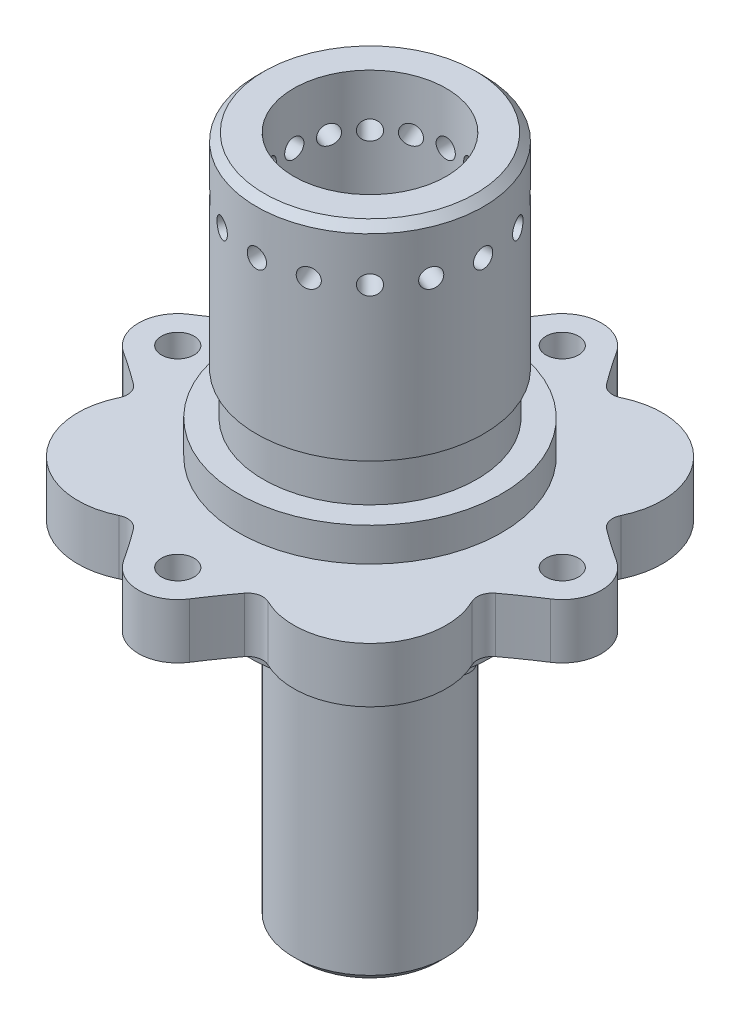
from build123d import *

# Parameters (mm, degrees)
SKETCH5_W                     = 15.875
SKETCH5_H                     = 79.375
DRIVE_PIN_HOLES_D             = 6.8
DRIVE_PIN_HOLES_PATTERN_COUNT = 4
FLANGE_SUPPORT_CUT_REACH      = 105.717
SKETCH8_R                     = 52.5
SKETCH10_R                    = 25.0825
BRAKE_HAT_HEX_DEPTH           = 4.7625
F_5_16_CLEARANCE_HOLE1_D      = 8.4328
SKETCH14_R                    = 2
PIN_HOLES_DEPTH               = 100.418201231
PIN_HOLE_PATTERN_COUNT        = 16
FILLET1_R                     = 3.175
FILLET2_R                     = 3.175


with BuildPart() as part:
    # Sketch1 → Bearing Shaft/Flange Support (revolve)
    with BuildSketch(Plane(origin=(0, 0, 0), x_dir=(0, 0, -1), z_dir=(1, 0, 0))):
        Polygon((0, 0), (-27.254672075, 0), (-25.0825, -12.319), (-25.0825, -17.0815), (-15.875, -17.0815), (-15.875, -70.83298), (-14.2875, -72.42048), (0, -72.42048), align=None)
    revolve(axis=Axis((0, 0, 0), (0, 1, 0)))

    # Sketch2 → Drive Pin Support (revolve)
    with BuildSketch(Plane(origin=(0, 0, 0), x_dir=(0, 0, -1), z_dir=(1, 0, 0))):
        Polygon((0, 0), (-52.5, 0), (-52.5, 11.43), (-27.4096, 11.43), (-27.4096, 18.43), (-22.225, 18.43), (-22.225, 27.305), (-23.61946, 27.305), (-23.61946, 68.2625), (-22.03196, 69.85), (0, 69.85), align=None)
    revolve(axis=Axis((0, 0, 0), (0, 1, 0)))

    # Sketch5 → Center Mass Removal (revolve, cut)
    with BuildSketch(Plane(origin=(0, 0, 0), x_dir=(0, 0, -1), z_dir=(1, 0, 0))):
        with Locations((7.9375, 30.1625)):
            Rectangle(SKETCH5_W, SKETCH5_H)
    revolve(axis=Axis((0, 0, 0), (0, -1, 0)), mode=Mode.SUBTRACT)

    # Drive Pin Holes (through all)
    with Locations(Plane(origin=(0, 0, 0), x_dir=(-1, 0, 0), z_dir=(0, -1, 0))):
        with Locations((0, -40)):
            drive_pin_holes = Hole(DRIVE_PIN_HOLES_D / 2)

    # Drive Pin Holes Pattern: Drive Pin Holes ×4 about axis
    drive_pin_holes_pattern_axis = Axis((0, 0, 0), (0, -1, 0))
    for i in range(1, DRIVE_PIN_HOLES_PATTERN_COUNT):
        add(drive_pin_holes.rotate(drive_pin_holes_pattern_axis, i * 360 / DRIVE_PIN_HOLES_PATTERN_COUNT), mode=Mode.SUBTRACT)

    # Sketch8 → Flange Support Cut (cut, up to next)
    with BuildSketch(Plane.XZ, mode=Mode.PRIVATE) as flange_support_cut_sk1:
        Circle(SKETCH8_R)
        with BuildLine():
            ThreePointArc((-6.851776468, 44.436165629), (0, 48.1625), (6.851776468, 44.436165629))
            ThreePointArc((6.851776468, 44.436165629), (9.964767607, 39.850591878), (13.274865482, 35.405206349))
            ThreePointArc((13.274865482, 35.405206349), (33.675960454, 33.675960454), (35.405206349, 13.274865482))
            ThreePointArc((35.405206349, 13.274865482), (39.850591878, 9.964767607), (44.436165629, 6.851776468))
            ThreePointArc((44.436165629, 6.851776468), (48.1625, 0), (44.436165629, -6.851776468))
            ThreePointArc((44.436165629, -6.851776468), (39.850591878, -9.964767607), (35.405206349, -13.274865482))
            ThreePointArc((35.405206349, -13.274865482), (33.675960454, -33.675960454), (13.274865482, -35.405206349))
            ThreePointArc((13.274865482, -35.405206349), (9.964767607, -39.850591878), (6.851776468, -44.436165629))
            ThreePointArc((6.851776468, -44.436165629), (0, -48.1625), (-6.851776468, -44.436165629))
            ThreePointArc((-6.851776468, -44.436165629), (-9.964767607, -39.850591878), (-13.274865482, -35.405206349))
            ThreePointArc((-13.274865482, -35.405206349), (-33.675960454, -33.675960454), (-35.405206349, -13.274865482))
            ThreePointArc((-35.405206349, -13.274865482), (-39.850591878, -9.964767607), (-44.436165629, -6.851776468))
            ThreePointArc((-44.436165629, -6.851776468), (-48.1625, 0), (-44.436165629, 6.851776468))
            ThreePointArc((-44.436165629, 6.851776468), (-39.850591878, 9.964767607), (-35.405206349, 13.274865482))
            ThreePointArc((-35.405206349, 13.274865482), (-33.675960454, 33.675960454), (-13.274865482, 35.405206349))
            ThreePointArc((-13.274865482, 35.405206349), (-9.964767607, 39.850591878), (-6.851776468, 44.436165629))
        make_face(mode=Mode.SUBTRACT)
    flange_support_cut_tool1 = extrude(flange_support_cut_sk1.sketch, amount=-FLANGE_SUPPORT_CUT_REACH, mode=Mode.PRIVATE) & part.part
    add(flange_support_cut_tool1.solids().sort_by_distance((-51.015076, 0, 0))[0], mode=Mode.SUBTRACT)

    # Sketch10 → Brake Hat Hex (cut)
    with BuildSketch(Plane.XZ.offset(17.0815)):
        Circle(SKETCH10_R)
        Polygon((10.631905207, -18.415), (21.263810414, 0), (10.631905207, 18.415), (-10.631905207, 18.415), (-21.263810414, 0), (-10.631905207, -18.415), align=None, mode=Mode.SUBTRACT)
    extrude(amount=-BRAKE_HAT_HEX_DEPTH, mode=Mode.SUBTRACT)

    # 5/16 Clearance Hole1 (through all)
    with Locations(Plane(origin=(0, -72.42048, 0), x_dir=(-1, 0, 0), z_dir=(0, -1, 0))):
        with Locations((0, 0)):
            Hole(F_5_16_CLEARANCE_HOLE1_D / 2)

    # Sketch14 → Pin Holes (cut, through all)
    with BuildSketch(Plane(origin=(0, 0, 0), x_dir=(0, 0, -1), z_dir=(1, 0, 0))):
        with Locations((0, 59.05)):
            Circle(SKETCH14_R)
    pin_holes = extrude(amount=-PIN_HOLES_DEPTH, mode=Mode.SUBTRACT)

    # Pin Hole Pattern: Pin Holes ×16 about axis
    pin_hole_pattern_axis = Axis((0, 0, 0), (0, -1, 0))
    for i in range(1, PIN_HOLE_PATTERN_COUNT):
        add(pin_holes.rotate(pin_hole_pattern_axis, i * 360 / PIN_HOLE_PATTERN_COUNT), mode=Mode.SUBTRACT)

    # Fillet1
    fillet1_edges = [part.edges().sort_by_distance(p)[0] for p in [
        (-13.274865482, 5.715, 35.405206349),
        (-35.405206349, 5.715, 13.274865482),
        (-35.405206349, 5.715, -13.274865482),
        (-13.274865482, 5.715, -35.405206349),
        (13.274865482, 5.715, -35.405206349),
        (35.405206349, 5.715, -13.274865482),
        (35.405206349, 5.715, 13.274865482),
        (13.274865482, 5.715, 35.405206349),
    ]]
    fillet(fillet1_edges, radius=FILLET1_R)

    # Fillet2
    fillet2_edges = [part.edges().sort_by_distance(p)[0] for p in [
        (-21.263810414, -14.70025, 0),
        (-10.631905207, -14.70025, -18.415),
        (10.631905207, -14.70025, -18.415),
        (21.263810414, -14.70025, 0),
        (10.631905207, -14.70025, 18.415),
        (-10.631905207, -14.70025, 18.415),
    ]]
    fillet(fillet2_edges, radius=FILLET2_R)


solid = part.part
